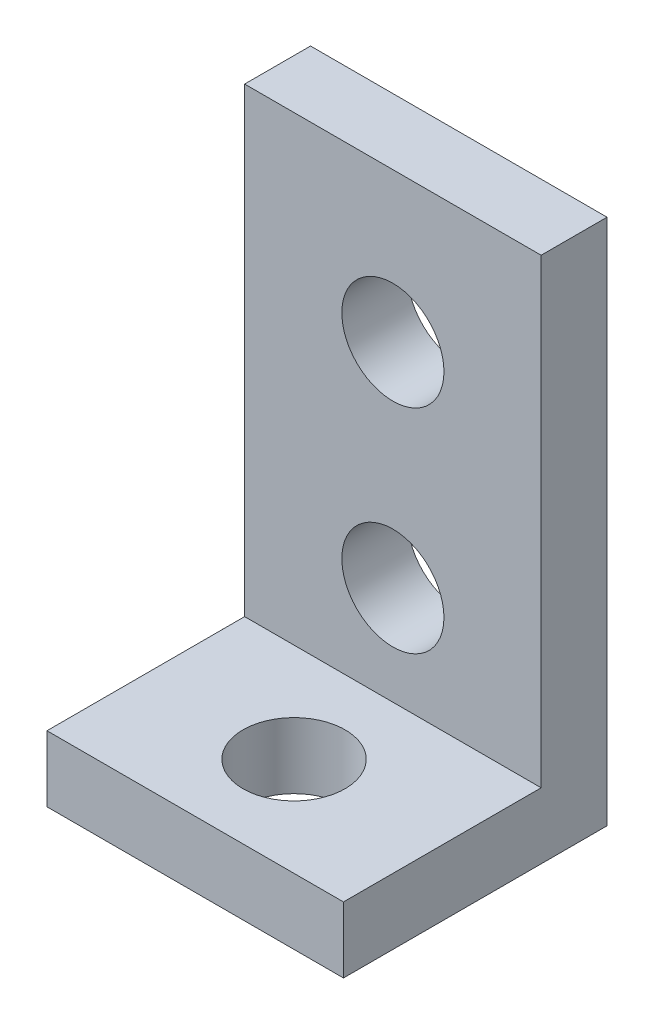
from build123d import *

# Parameters (mm, degrees)
EXTRUDE_1_DEPTH     = 9
SKETCH_3D_2_R       = 1.55
CUT_EXTRUDE_1_DEPTH = 16.532224567
SKETCH_3D_3_R       = 1.55
CUT_EXTRUDE_2_DEPTH = 15.685502288


with BuildPart() as part:
    # 草图1 → 凸台-拉伸1 (new body)
    with BuildSketch(Plane(origin=(0, 0, 0), x_dir=(0, 0, -1), z_dir=(1, 0, 0))):
        Polygon((0, 0), (8, 0), (8, 16), (6, 16), (6, 2), (0, 2), align=None)
    extrude(amount=EXTRUDE_1_DEPTH)

    # Sketch 3D_2 → 切除-拉伸1 (cut, through all)
    with BuildSketch(Plane(origin=(4.5, 2, -3), x_dir=(0, 0, 1), z_dir=(0, 1, 0))):
        Circle(SKETCH_3D_2_R)
    extrude(amount=-CUT_EXTRUDE_1_DEPTH, mode=Mode.SUBTRACT)

    # Sketch 3D_3 → 切除-拉伸2 (cut, through all)
    with BuildSketch(Plane(origin=(4.5, 11.463593567, -8), x_dir=(0, -1, 0), z_dir=(0, 0, -1))):
        Circle(SKETCH_3D_3_R)
        with Locations((6.462008135, 0)):
            Circle(SKETCH_3D_3_R)
    extrude(amount=-CUT_EXTRUDE_2_DEPTH, mode=Mode.SUBTRACT)


solid = part.part
